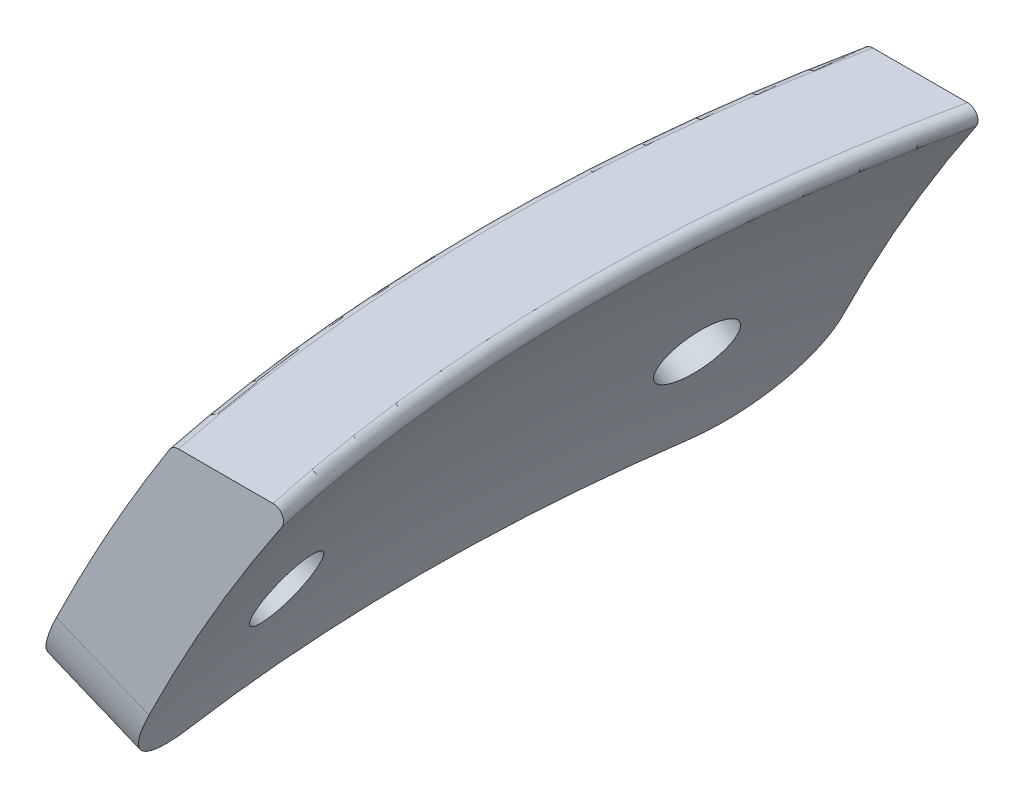
from build123d import *

# Parameters (mm, degrees)
REVOLVE1_ANGLE      = 25
SKETCH5_OUTSIDE_W   = 49.918
SKETCH5_OUTSIDE_H   = 98.58
SKETCH5_OUTSIDE_W_2 = 49.942234294
SKETCH5_OUTSIDE_H_2 = 67.217175432
CUT_EXTRUDE2_DEPTH  = 270.042543656
FILLET1_R           = 10
FILLET2_R           = 1


with BuildPart() as part:
    # Sketch1 → Revolve1 (revolve, symmetric)
    with BuildSketch(Plane.XY) as revolve1_sk:
        with BuildLine():
            Line((-166.646098372, 194.668503093), (-155.279281385, 194.668503093))
            ThreePointArc((-155.279281385, 194.668503093), (-158.36020454, 189.951263841), (-161.297868615, 185.143503093))
            ThreePointArc((-161.297868615, 185.143503093), (-167.398002542, 173.962532431), (-172.72424769, 162.392880254))
            Line((-172.72424769, 162.392880254), (-181.506836555, 166.07958038))
            ThreePointArc((-181.506836555, 166.07958038), (-174.662383329, 180.678605233), (-166.646098372, 194.668503093))
        make_face()
    revolve(axis=Axis((0, 0, 0), (0, 1, 0)), revolution_arc=REVOLVE1_ANGLE / 2)
    revolve(revolve1_sk.sketch, axis=Axis((0, 0, 0), (0, -1, 0)), revolution_arc=REVOLVE1_ANGLE / 2)

    # Sketch4 → Cut-Revolve1 (revolve, cut)
    with BuildSketch(Plane(origin=(36.360369904, 71.361243959, 0), x_dir=(-0.8910065241883692, 0.45399049973954425, 0), z_dir=(0.4539904997395442, 0.8910065241883691, 0))):
        Polygon((219.568830697, 22.795302532), (238.837118843, 24.48105931), (239.148428262, 20.922776373), (219.880140115, 19.237019595), align=None)
    cut_revolve1 = revolve(axis=Axis((-159.554269478, 171.184738652, 19.237019595), (-0.8876159753616076, 0.45226292882455665, 0.08715574274765846)), mode=Mode.SUBTRACT)

    # Mirror1: Cut-Revolve1 across plane
    add(cut_revolve1.mirror(Plane.XY), mode=Mode.SUBTRACT)

    # Sketch5 outside → Cut-Extrude2 (cut, through all)
    with BuildSketch(Plane(origin=(0, 0, 0), x_dir=(1, 0, 0), z_dir=(0, 1, 0))):
        with Locations((-166.553, 0)):
            Rectangle(SKETCH5_OUTSIDE_W, SKETCH5_OUTSIDE_H)
        with Locations((-176.569659552, 0)):
            Rectangle(SKETCH5_OUTSIDE_W_2, SKETCH5_OUTSIDE_H_2, mode=Mode.SUBTRACT)
    extrude(amount=CUT_EXTRUDE2_DEPTH, mode=Mode.SUBTRACT)

    # Fillet1
    fillet1_edges = [part.edges().sort_by_distance(p)[0] for p in [
        (-173.895836617, 164.235500217, -33.608587716),
        (-173.895836617, 164.235500217, 33.608587716),
    ]]
    fillet(fillet1_edges, radius=FILLET1_R)

    # Fillet2
    fillet2_edges = [part.edges().sort_by_distance(p)[0] for p in [
        (-166.646098372, 194.668503093, 0),
        (-155.279281385, 194.668503093, 0),
    ]]
    fillet(fillet2_edges, radius=FILLET2_R)


solid = part.part
